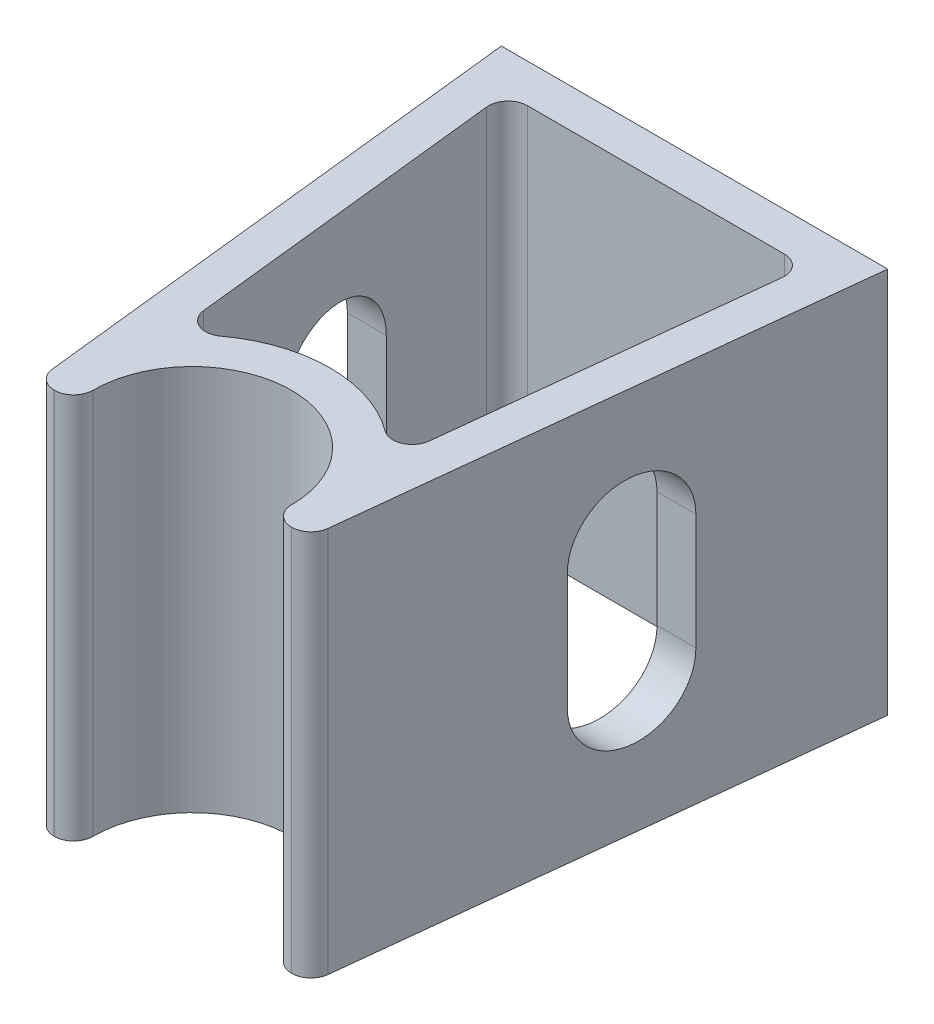
from build123d import *

# Parameters (mm, degrees)
BOSS_EXTRUDE1_DEPTH     = 50
CUT_EXTRUDE1_DEPTH      = 86.732140997
CUT_EXTRUDE1_DEPTH_BACK = 86.732140997
FILLET2_R               = 2.5
CUT_EXTRUDE2_DEPTH      = 86.732140997
CUT_EXTRUDE2_DEPTH_BACK = 86.732140997


with BuildPart() as part:
    # Sketch1 → Boss-Extrude1 (new body)
    with BuildSketch(Plane(origin=(0, 0, 0), x_dir=(1, 0, 0), z_dir=(0, 1, 0))):
        with BuildLine():
            Line((-12.6, -2.5), (-17.6, -2.5))
            Line((-17.6, -2.5), (-25, 65))
            Line((-25, 65), (25, 65))
            Line((25, 65), (17.6, -2.5))
            Line((17.6, -2.5), (12.6, -2.5))
            ThreePointArc((12.6, -2.5), (0, 12.845621822), (-12.6, -2.5))
        make_face()
    extrude(amount=BOSS_EXTRUDE1_DEPTH)

    # Sketch2 → Cut-Extrude1 (cut, two sides: drawn at the far end of the back side and taken through both)
    with BuildSketch(Plane(origin=(0, 50, 0), x_dir=(1, 0, 0), z_dir=(0, 1, 0)).offset(-CUT_EXTRUDE1_DEPTH_BACK)):
        with BuildLine():
            Line((14.050316299, 11.002491996), (19.421894954, 60))
            Line((19.421894954, 60), (-19.421894954, 60))
            Line((-19.421894954, 60), (-14.050316299, 11.002491996))
            ThreePointArc((-14.050316299, 11.002491996), (0, 17.845621822), (14.050316299, 11.002491996))
        make_face()
    extrude(amount=CUT_EXTRUDE1_DEPTH + CUT_EXTRUDE1_DEPTH_BACK, mode=Mode.SUBTRACT)

    # Fillet2
    fillet2_edges = [part.edges().sort_by_distance(p)[0] for p in [
        (-19.421894954, 25, -60),
        (19.421894954, 25, -60),
        (14.050316299, 25, -11.002491996),
        (-14.050316299, 25, -11.002491996),
        (17.6, 25, 2.5),
        (12.6, 25, 2.5),
        (-17.6, 25, 2.5),
        (-12.6, 25, 2.5),
    ]]
    fillet(fillet2_edges, radius=FILLET2_R)

    # Sketch3 → Cut-Extrude2 (cut, two sides: drawn at the far end of the back side and taken through both)
    with BuildSketch(Plane(origin=(0, 0, 0), x_dir=(0, 0, -1), z_dir=(1, 0, 0)).offset(-CUT_EXTRUDE2_DEPTH_BACK)):
        with BuildLine():
            Line((42.627558228, 32.5), (42.627558228, 17.5))
            ThreePointArc((42.627558228, 17.5), (35.127558228, 10), (27.627558228, 17.5))
            Line((27.627558228, 17.5), (27.627558228, 32.5))
            ThreePointArc((27.627558228, 32.5), (35.127558228, 40), (42.627558228, 32.5))
        make_face()
    extrude(amount=CUT_EXTRUDE2_DEPTH + CUT_EXTRUDE2_DEPTH_BACK, mode=Mode.SUBTRACT)


solid = part.part
